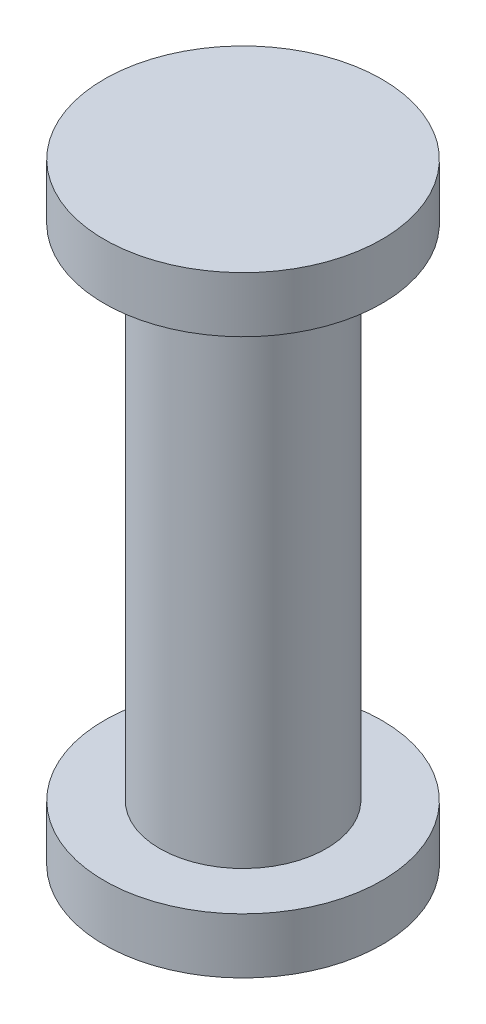
from build123d import *


with BuildPart() as part:
    # Эскиз1 → Повернуть1 (revolve)
    with BuildSketch(Plane.XY):
        Polygon((0, 0), (0, 11), (-2.5, 11), (-2.5, 10), (-1.5, 10), (-1.5, 1), (-2.5, 1), (-2.5, 0), align=None)
    revolve(axis=Axis((0, 0, 0), (0, 1, 0)))


solid = part.part
